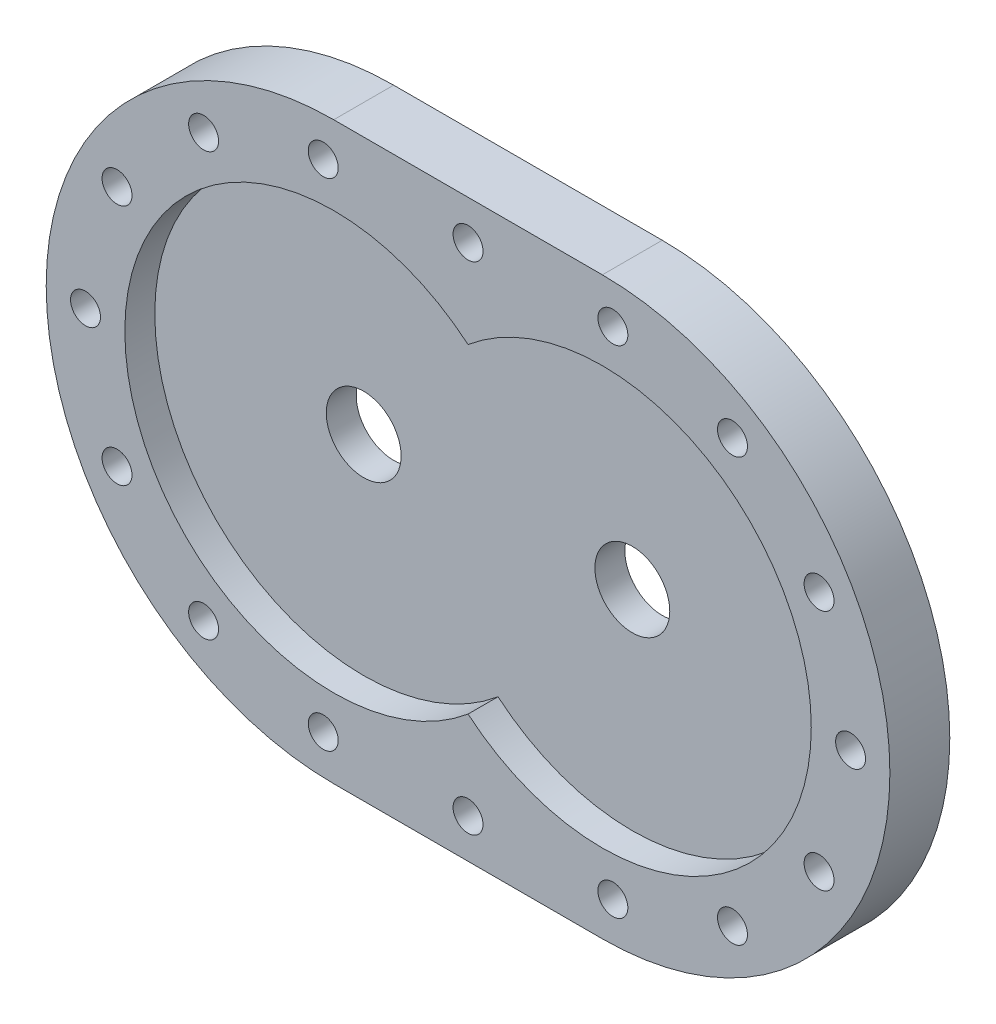
from build123d import *

# Parameters (mm, degrees)
BOSS_EXTRUDE1_DEPTH   = 20
SKETCH2_R             = 69.75
CUT_EXTRUDE1_DEPTH    = 10
SKETCH3_R             = 12.5
CUT_EXTRUDE2_DEPTH    = 210.276793028
SKETCH4_R             = 5
CUT_EXTRUDE3_DEPTH    = 210.992323907
CRVPATTERN2_OUTLINE_R = 5
CRVPATTERN2_DEPTH     = 20


# Read off the part's stored shape, not the designer's step: CrvPattern2
with BuildPart() as part:
    # Sketch1 → Boss-Extrude1 (new body)
    with BuildSketch(Plane.XY):
        with BuildLine():
            Line((0, 96), (89.69, 96))
            ThreePointArc((89.69, 96), (185.69, 0), (89.69, -96))
            Line((89.69, -96), (0, -96))
            ThreePointArc((0, -96), (-96, 0), (0, 96))
        make_face()
    extrude(amount=BOSS_EXTRUDE1_DEPTH)

    # Sketch2 → Cut-Extrude1 (cut)
    with BuildSketch(Plane.XY.offset(20)):
        with Locations((89.69, 0)):
            Circle(SKETCH2_R)
        Circle(SKETCH2_R)
    extrude(amount=-CUT_EXTRUDE1_DEPTH, mode=Mode.SUBTRACT)

    # Sketch3 → Cut-Extrude2 (cut, through all)
    with BuildSketch(Plane.XY.offset(10)):
        Circle(SKETCH3_R)
        with Locations((89.69, 0)):
            Circle(SKETCH3_R)
    extrude(amount=-CUT_EXTRUDE2_DEPTH, mode=Mode.SUBTRACT)

    # Sketch4 → Cut-Extrude3 (cut, through all)
    with BuildSketch(Plane.XY.offset(20)):
        with Locations((172.565, 0)):
            Circle(SKETCH4_R)
    extrude(amount=-CUT_EXTRUDE3_DEPTH, mode=Mode.SUBTRACT)

    # CrvPattern2 outline → CrvPattern2 (cut)
    with BuildSketch(Plane.XY):
        with Locations((162.039610622, 40.420285352)):
            Circle(CRVPATTERN2_OUTLINE_R)
        with Locations((162.039610622, -40.420285352)):
            Circle(CRVPATTERN2_OUTLINE_R)
        with Locations((133.136958542, -70.573560335)):
            Circle(CRVPATTERN2_OUTLINE_R)
        with Locations((93.198501794, -82.800700723)):
            Circle(CRVPATTERN2_OUTLINE_R)
        with Locations((44.845, -82.875)):
            Circle(CRVPATTERN2_OUTLINE_R)
        with Locations((-3.508501794, -82.800700723)):
            Circle(CRVPATTERN2_OUTLINE_R)
        with Locations((-43.446958542, -70.573560335)):
            Circle(CRVPATTERN2_OUTLINE_R)
        with Locations((-72.349610622, -40.420285352)):
            Circle(CRVPATTERN2_OUTLINE_R)
        with Locations((-82.875, 0)):
            Circle(CRVPATTERN2_OUTLINE_R)
        with Locations((-72.349610622, 40.420285352)):
            Circle(CRVPATTERN2_OUTLINE_R)
        with Locations((-43.446958542, 70.573560335)):
            Circle(CRVPATTERN2_OUTLINE_R)
        with Locations((-3.508501794, 82.800700723)):
            Circle(CRVPATTERN2_OUTLINE_R)
        with Locations((44.845, 82.875)):
            Circle(CRVPATTERN2_OUTLINE_R)
        with Locations((93.198501794, 82.800700723)):
            Circle(CRVPATTERN2_OUTLINE_R)
        with Locations((133.136958542, 70.573560335)):
            Circle(CRVPATTERN2_OUTLINE_R)
    extrude(amount=CRVPATTERN2_DEPTH, mode=Mode.SUBTRACT)


solid = part.part
